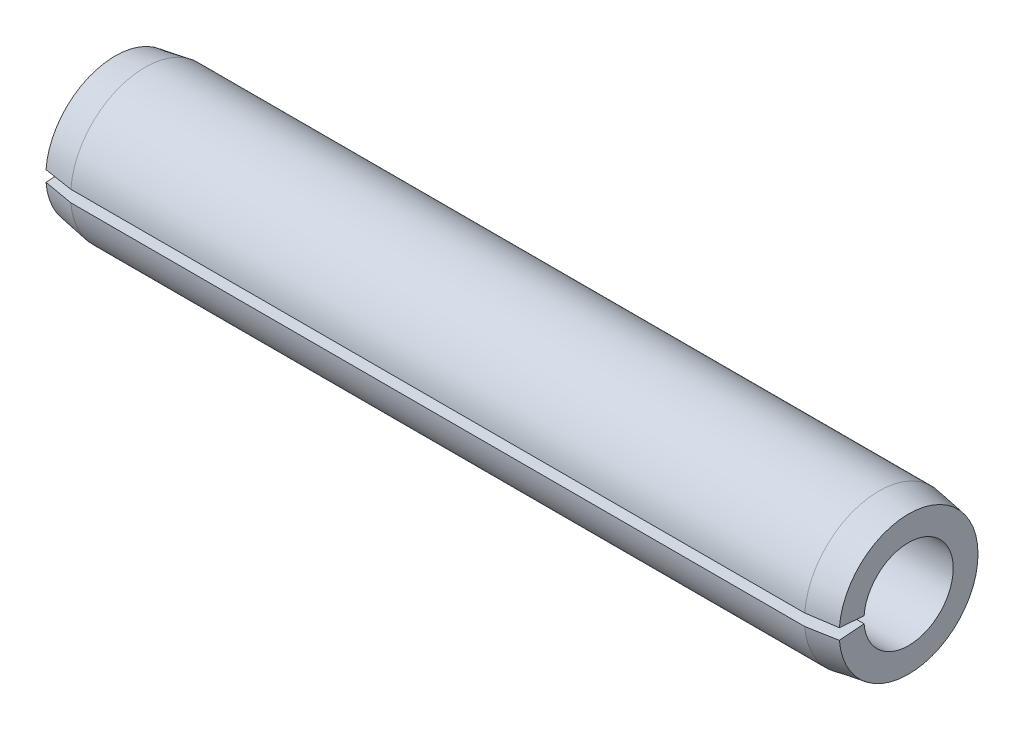
from build123d import *

# Parameters (mm, degrees)
GAP_DEPTH = 103.489078686


with BuildPart() as part:
    # Sketch1 → Base-Revolve (revolve)
    with BuildSketch(Plane.XY):
        Polygon((0, 5.715), (101.6, 5.715), (101.6, 8.89), (97.79, 9.525), (3.81, 9.525), (0, 8.89), align=None)
    revolve(axis=Axis((-9.525, 0, 0), (1, 0, 0)))

    # Sketch2 → Gap (cut, through all)
    with BuildSketch(Plane(origin=(0, 0, 0), x_dir=(0, -1, 0), z_dir=(-1, 0, 0))):
        with BuildLine():
            Line((0, 0), (0.762269345, 9.685550356))
            ThreePointArc((0.762269345, 9.685550356), (0, 9.7155), (-0.762269345, 9.685550356))
            Line((-0.762269345, 9.685550356), (0, 0))
        make_face()
    extrude(amount=-GAP_DEPTH, mode=Mode.SUBTRACT)


solid = part.part
